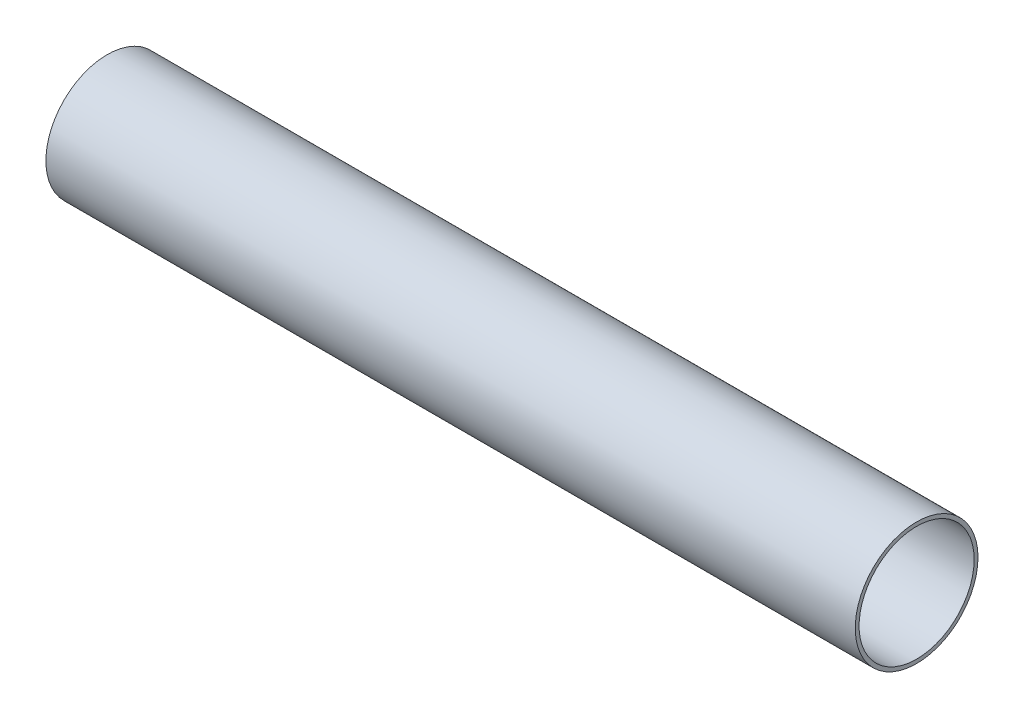
from build123d import *

# Parameters (mm, degrees)
SKETCH1_R           = 25.4
SKETCH1_R_2         = 23.8125
EXTRUDE_THIN1_DEPTH = 167.48125


with BuildPart() as part:
    # Sketch1 → Extrude-Thin1 (new, symmetric)
    with BuildSketch(Plane(origin=(0, 0, 0), x_dir=(0, 0, -1), z_dir=(1, 0, 0))):
        Circle(SKETCH1_R)
        Circle(SKETCH1_R_2, mode=Mode.SUBTRACT)
    extrude(amount=EXTRUDE_THIN1_DEPTH, both=True)


solid = part.part
